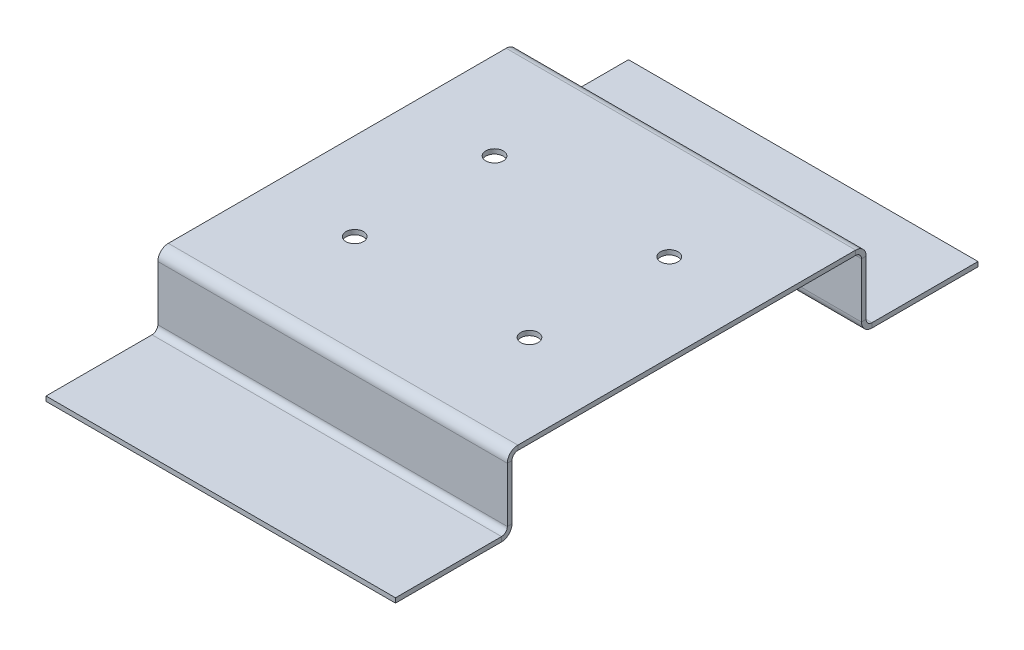
from build123d import *

# Parameters (mm, degrees)
SKETCH7_W                      = 60
SKETCH7_H                      = 60
BASE_FLANGE2_DEPTH             = 0.8
EDGE_FLANGE1_STRIP_W           = 5.2
EDGE_FLANGE1_STRIP_H           = 0.8
EDGE_FLANGE1_STRIP_CUT_DEPTH   = 60
EDGE_FLANGE1_STRIP_2_W         = 5.2
EDGE_FLANGE1_STRIP_2_H         = 0.8
EDGE_FLANGE1_STRIP_CUT_2_DEPTH = 60
EDGE_FLANGE1_DEPTH             = 60
EDGE_FLANGE1_BEND_DEPTH        = 60
EDGE_FLANGE2_STRIP_W           = 5.2
EDGE_FLANGE2_STRIP_H           = 0.8
EDGE_FLANGE2_STRIP_CUT_DEPTH   = 60
EDGE_FLANGE2_STRIP_2_W         = 5.2
EDGE_FLANGE2_STRIP_2_H         = 0.8
EDGE_FLANGE2_STRIP_CUT_2_DEPTH = 60
EDGE_FLANGE2_DEPTH             = 60
EDGE_FLANGE2_BEND_DEPTH        = 60
SKETCH22_R                     = 1.5
CUT_EXTRUDE2_DEPTH             = 60.741108125


# Sheet-metal steps are written as plain solids
with BuildPart() as part:
    # Sketch7 → Base-Flange2 (new body)
    with BuildSketch(Plane(origin=(0, 0, 0), x_dir=(1, 0, 0), z_dir=(0, 1, 0))):
        Rectangle(SKETCH7_W, SKETCH7_H)
    extrude(amount=-BASE_FLANGE2_DEPTH)

    # Edge-Flange1 strip (across the edge) → Edge-Flange1 strip cut (cut)
    with BuildSketch(Plane(origin=(-30, -0.8, -30), x_dir=(0, 0, 1), z_dir=(1, 0, 0))):
        with Locations((-1.6, -0.4)):
            Rectangle(EDGE_FLANGE1_STRIP_W, EDGE_FLANGE1_STRIP_H)
    extrude(amount=EDGE_FLANGE1_STRIP_CUT_DEPTH, mode=Mode.SUBTRACT)

    # Edge-Flange1 strip 2 (across the edge) → Edge-Flange1 strip cut 2 (cut)
    with BuildSketch(Plane(origin=(30, -0.8, 30), x_dir=(0, 0, -1), z_dir=(-1, 0, 0))):
        with Locations((-1.6, -0.4)):
            Rectangle(EDGE_FLANGE1_STRIP_2_W, EDGE_FLANGE1_STRIP_2_H)
    extrude(amount=EDGE_FLANGE1_STRIP_CUT_2_DEPTH, mode=Mode.SUBTRACT)

    # Edge-Flange1 section (across the edge) → Edge-Flange1 (add)
    with BuildSketch(Plane(origin=(-30, -0.8, -30), x_dir=(0, 0, 1), z_dir=(1, 0, 0))):
        with BuildLine():
            Line((-0.8, 1), (-0.8, 12.2))
            Line((-0.8, 12.2), (0, 12.2))
            Line((0, 12.2), (0, 1))
            ThreePointArc((0, 1), (0.292893219, 0.292893219), (1, 0))
            Line((1, 0), (1, -0.8))
            ThreePointArc((1, -0.8), (-0.272792206, -0.272792206), (-0.8, 1))
        make_face()
    extrude(amount=EDGE_FLANGE1_DEPTH)

    # Edge-Flange1 section 2 (across the edge) → Edge-Flange1 bend (add)
    with BuildSketch(Plane(origin=(30, -0.8, 30), x_dir=(0, 0, -1), z_dir=(-1, 0, 0))):
        with BuildLine():
            Line((-0.8, 1), (-0.8, 12.2))
            Line((-0.8, 12.2), (0, 12.2))
            Line((0, 12.2), (0, 1))
            ThreePointArc((0, 1), (0.292893219, 0.292893219), (1, 0))
            Line((1, 0), (1, -0.8))
            ThreePointArc((1, -0.8), (-0.272792206, -0.272792206), (-0.8, 1))
        make_face()
    extrude(amount=EDGE_FLANGE1_BEND_DEPTH)

    # Edge-Flange2 strip (across the edge) → Edge-Flange2 strip cut (cut)
    with BuildSketch(Plane(origin=(-30, -13, 30.8), x_dir=(0, 1, 0), z_dir=(1, 0, 0))):
        with Locations((-0.8, -0.4)):
            Rectangle(EDGE_FLANGE2_STRIP_W, EDGE_FLANGE2_STRIP_H)
    extrude(amount=EDGE_FLANGE2_STRIP_CUT_DEPTH, mode=Mode.SUBTRACT)

    # Edge-Flange2 strip 2 (across the edge) → Edge-Flange2 strip cut 2 (cut)
    with BuildSketch(Plane(origin=(30, -13, -30.8), x_dir=(0, 1, 0), z_dir=(-1, 0, 0))):
        with Locations((-0.8, -0.4)):
            Rectangle(EDGE_FLANGE2_STRIP_2_W, EDGE_FLANGE2_STRIP_2_H)
    extrude(amount=EDGE_FLANGE2_STRIP_CUT_2_DEPTH, mode=Mode.SUBTRACT)

    # Edge-Flange2 section (across the edge) → Edge-Flange2 (add)
    with BuildSketch(Plane(origin=(-30, -13, 30.8), x_dir=(0, 1, 0), z_dir=(1, 0, 0))):
        with BuildLine():
            Line((0, 1), (0, 19.2))
            Line((0, 19.2), (0.8, 19.2))
            Line((0.8, 19.2), (0.8, 1))
            ThreePointArc((0.8, 1), (1.092893219, 0.292893219), (1.8, 0))
            Line((1.8, 0), (1.8, -0.8))
            ThreePointArc((1.8, -0.8), (0.527207794, -0.272792206), (0, 1))
        make_face()
    extrude(amount=EDGE_FLANGE2_DEPTH)

    # Edge-Flange2 section 2 (across the edge) → Edge-Flange2 bend (add)
    with BuildSketch(Plane(origin=(30, -13, -30.8), x_dir=(0, 1, 0), z_dir=(-1, 0, 0))):
        with BuildLine():
            Line((0, 1), (0, 19.2))
            Line((0, 19.2), (0.8, 19.2))
            Line((0.8, 19.2), (0.8, 1))
            ThreePointArc((0.8, 1), (1.092893219, 0.292893219), (1.8, 0))
            Line((1.8, 0), (1.8, -0.8))
            ThreePointArc((1.8, -0.8), (0.527207794, -0.272792206), (0, 1))
        make_face()
    extrude(amount=EDGE_FLANGE2_BEND_DEPTH)

    # Sketch22 → Cut-Extrude2 (cut, through all)
    with BuildSketch(Plane(origin=(0, 0, 0), x_dir=(1, 0, 0), z_dir=(0, 1, 0))):
        with Locations(Location((-15, 12, 0), (0, 0, 270))):
            Circle(SKETCH22_R)
        with Locations(Location((15, 12, 0), (0, 0, 270))):
            Circle(SKETCH22_R)
        with Locations(Location((15, -12, 0), (0, 0, 270))):
            Circle(SKETCH22_R)
        with Locations(Location((-15, -12, 0), (0, 0, 270))):
            Circle(SKETCH22_R)
    extrude(amount=-CUT_EXTRUDE2_DEPTH, mode=Mode.SUBTRACT)


solid = part.part
